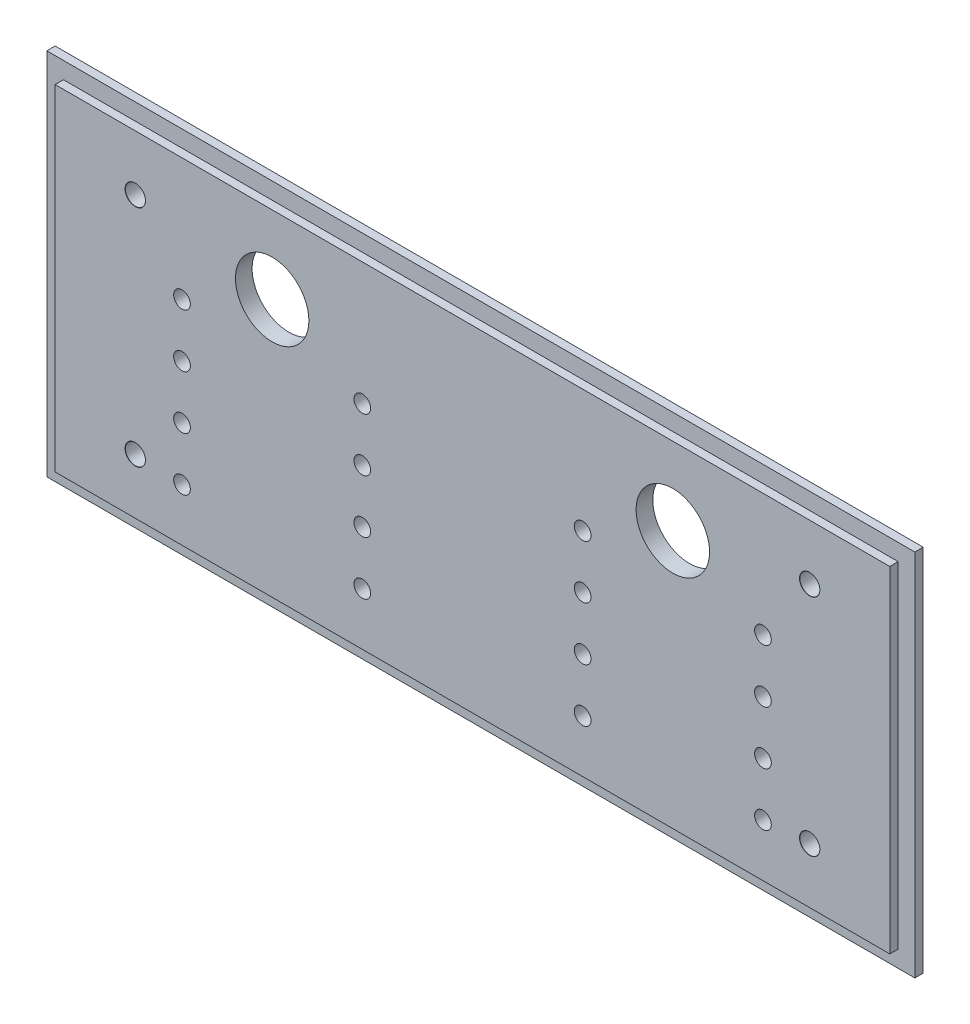
from build123d import *

# Parameters (mm, degrees)
ESBO_O1_W                         = 130
ESBO_O1_H                         = 55.25
RESSALTO_EXTRUS_O1_DEPTH          = 2.5
ESBO_O2_W                         = 130
ESBO_O2_H                         = 55.25
ESBO_O2_W_2                       = 125
ESBO_O2_H_2                       = 50.25
CORTE_EXTRUS_O1_DEPTH             = 1.25
FUROS_GUIA_COM_3_0MM2_D           = 3
FUROS_GUIA_COM_3_0MM2_CSINK_D     = 3.05
FUROS_GUIA_COM_3_0MM2_CSINK_ANGLE = 90
SKETCH1_R                         = 5.5
SKETCH1_R_2                       = 1.25
CUT_EXTRUDE1_DEPTH                = 10


with BuildPart() as part:
    # Esboço1 → Ressalto-extrusão1 (new body)
    with BuildSketch(Plane.XY):
        with Locations((1.708397535, 5.726309707)):
            Rectangle(ESBO_O1_W, ESBO_O1_H)
    extrude(amount=RESSALTO_EXTRUS_O1_DEPTH)

    # Esboço2 → Corte-extrusão1 (cut)
    with BuildSketch(Plane.XY.offset(2.5)):
        with Locations((1.708397535, 5.726309707)):
            Rectangle(ESBO_O2_W, ESBO_O2_H)
        with Locations((1.708397535, 5.726309707)):
            Rectangle(ESBO_O2_W_2, ESBO_O2_H_2, mode=Mode.SUBTRACT)
    extrude(amount=-CORTE_EXTRUS_O1_DEPTH, mode=Mode.SUBTRACT)

    # Furos-guia com Ø3.0mm2 (through all)
    with Locations(Plane.XY.offset(2.5)):
        with Locations((-48.791602465, 22.551309707), (-48.791602465, -11.098690293), (52.208397535, -11.098690293), (52.208397535, 22.551309707)):
            CounterSinkHole(FUROS_GUIA_COM_3_0MM2_D / 2, FUROS_GUIA_COM_3_0MM2_CSINK_D / 2, counter_sink_angle=FUROS_GUIA_COM_3_0MM2_CSINK_ANGLE)

    # Sketch1 → Cut-Extrude1 (cut)
    with BuildSketch(Plane.XY.offset(2.5)):
        with Locations((-28.291602465, 19.226309707)):
            Circle(SKETCH1_R)
        with Locations((-41.791602465, 12.476309707)):
            Circle(SKETCH1_R_2)
        with Locations((-41.791602465, 4.476309707)):
            Circle(SKETCH1_R_2)
        with Locations((-41.791602465, -3.523690293)):
            Circle(SKETCH1_R_2)
        with Locations((-41.791602465, -11.523690293)):
            Circle(SKETCH1_R_2)
        with Locations((-14.791602465, 12.476309707)):
            Circle(SKETCH1_R_2)
        with Locations((-14.791602465, -11.523690293)):
            Circle(SKETCH1_R_2)
        with Locations((-14.791602465, 4.476309707)):
            Circle(SKETCH1_R_2)
        with Locations((-14.791602465, -3.523690293)):
            Circle(SKETCH1_R_2)
        with Locations((18.208397535, -11.523690293)):
            Circle(SKETCH1_R_2)
        with Locations((18.208397535, -3.523690293)):
            Circle(SKETCH1_R_2)
        with Locations((18.208397535, 4.476309707)):
            Circle(SKETCH1_R_2)
        with Locations((18.208397535, 12.476309707)):
            Circle(SKETCH1_R_2)
        with Locations((45.208397535, -11.523690293)):
            Circle(SKETCH1_R_2)
        with Locations((45.208397535, -3.523690293)):
            Circle(SKETCH1_R_2)
        with Locations((45.208397535, 4.476309707)):
            Circle(SKETCH1_R_2)
        with Locations((45.208397535, 12.476309707)):
            Circle(SKETCH1_R_2)
        with Locations((31.708397535, 19.226309707)):
            Circle(SKETCH1_R)
    extrude(amount=-CUT_EXTRUDE1_DEPTH, mode=Mode.SUBTRACT)


solid = part.part
